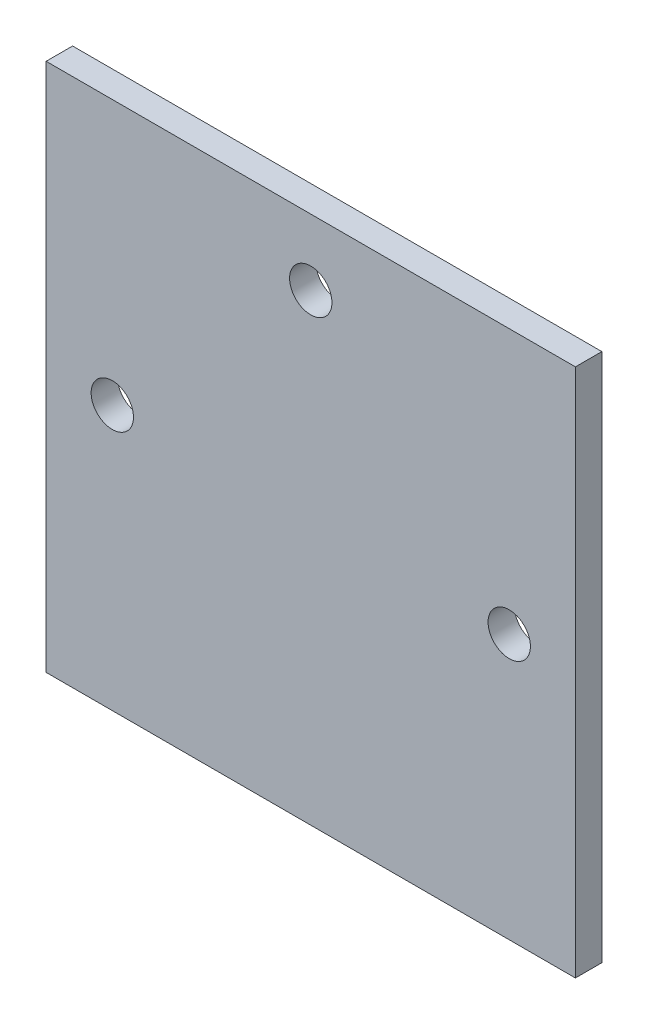
from build123d import *

# Parameters (mm, degrees)
SKETCH_1_W             = 200
SKETCH_1_H             = 200
SM_BASE_FLANGE_1_DEPTH = 10
SKETCH_3_R             = 8
CUT_EXTRUDE_1_DEPTH    = 10


# Sheet-metal steps are written as plain solids
with BuildPart() as part:
    # Sketch 1 → Базовая кромка1 (new body)
    with BuildSketch(Plane.XY):
        with Locations((100, -100)):
            Rectangle(SKETCH_1_W, SKETCH_1_H)
    extrude(amount=-SM_BASE_FLANGE_1_DEPTH)

    # Эскиз3 → Вырез-Вытянуть1 (cut)
    with BuildSketch(Plane(origin=(0, 0, -10), x_dir=(-1, 0, 0), z_dir=(0, 0, -1))):
        with Locations((-175, -100)):
            Circle(SKETCH_3_R)
        with Locations((-100, -25)):
            Circle(SKETCH_3_R)
        with Locations(Location((-25, -100, 0), (0, 0, 180))):
            Circle(SKETCH_3_R)
    extrude(amount=-CUT_EXTRUDE_1_DEPTH, mode=Mode.SUBTRACT)


solid = part.part
